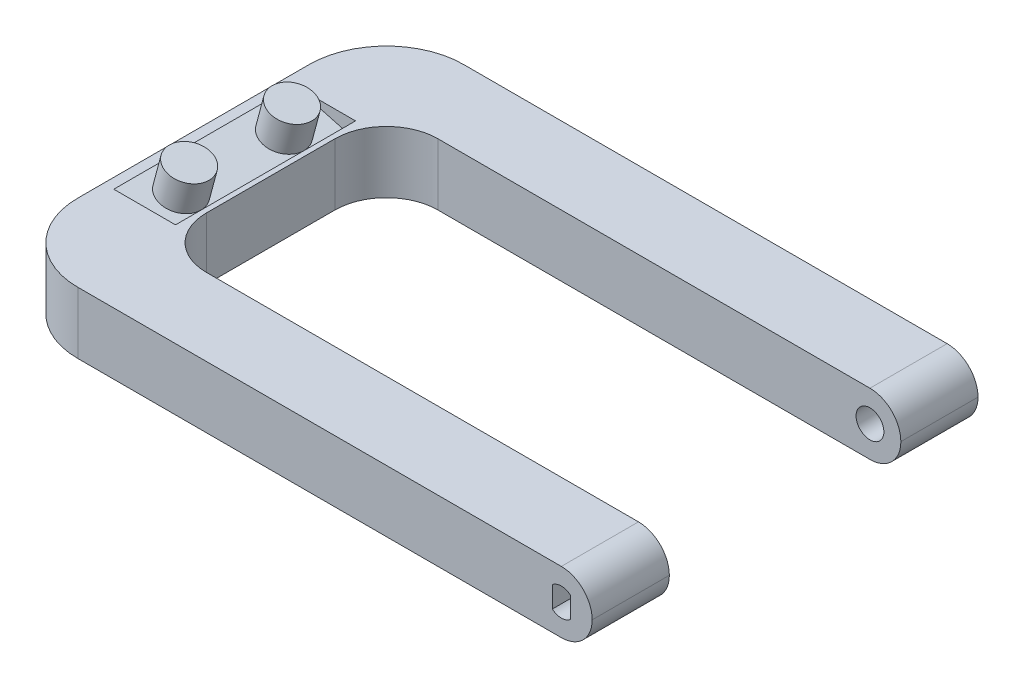
from build123d import *
from OCP.BRepFilletAPI import BRepFilletAPI_MakeFillet
from build123d.topology import SkipClean

# Parameters (mm, degrees)
BOSS_EXTRUDE1_DEPTH = 6
FILLET1_R           = 6
FILLET2_R1          = 10
FILLET2_R2          = 15
CUT_EXTRUDE1_DEPTH  = 17.5
SKETCH5_R           = 4
BOSS_EXTRUDE2_DEPTH = 6
CUT_EXTRUDE2_DEPTH  = 6
SKETCH7_R           = 2.7
CUT_EXTRUDE4_DEPTH  = 96.469302576


with BuildPart() as part:
    # Sketch1 → Boss-Extrude1 (new, symmetric)
    with BuildSketch(Plane(origin=(0, 0, 0), x_dir=(1, 0, 0), z_dir=(0, 1, 0))):
        Polygon((50, 37.5), (50, 22.5), (-50, 22.5), (-50, -22.5), (50, -22.5), (50, -37.5), (-65, -37.5), (-65, 37.5), align=None)
    extrude(amount=BOSS_EXTRUDE1_DEPTH, both=True)

    # Fillet1
    fillet1_edges = [part.edges().sort_by_distance(p)[0] for p in [
        (50, 6, -30),
        (50, -6, -30),
        (50, -6, 30),
        (50, 6, 30),
    ]]
    fillet(fillet1_edges, radius=FILLET1_R - 0.0001)  # a hair under: the kernel refuses the full size

    # Fillet2: one fillet with a radius per group of edges: ONE call of the kernel's fillet builder (fillet() takes one radius for all edges)
    fillet2_edges_1 = [part.edges().sort_by_distance(p)[0] for p in [
        (-50, 0, 22.5),
        (-50, 0, -22.5),
    ]]
    fillet2_edges_2 = [part.edges().sort_by_distance(p)[0] for p in [
        (-65, 0, 37.5),
        (-65, 0, -37.5),
    ]]
    fillet2 = BRepFilletAPI_MakeFillet(part.part.solid().wrapped)
    for e in fillet2_edges_1:
        fillet2.Add(FILLET2_R1, e.wrapped)
    for e in fillet2_edges_2:
        fillet2.Add(FILLET2_R2, e.wrapped)
    add(Compound.cast(fillet2.Shape()), mode=Mode.REPLACE)

    # Sketch4 → Cut-Extrude1 (cut, symmetric)
    with BuildSketch(Plane.XY):
        Polygon((-63, 6), (-51, 2.784609691), (-51, 6), align=None)
    extrude(amount=CUT_EXTRUDE1_DEPTH, both=True, mode=Mode.SUBTRACT)

    # Sketch5 → Boss-Extrude2 (add)
    with BuildSketch(Plane(origin=(-2.720199781, -10.151923789, 0), x_dir=(0.9659258262890701, -0.25881904510251424, 0), z_dir=(0.25881904510251424, 0.9659258262890701, 0))):
        with Locations((-56.610686369, 10)):
            Circle(SKETCH5_R)
        with Locations((-56.610686369, -10)):
            Circle(SKETCH5_R)
    extrude(amount=BOSS_EXTRUDE2_DEPTH)

    # Sketch6 → Cut-Extrude2 (cut)
    with BuildSketch(Plane.XY.offset(37.5)):
        with BuildLine():
            Line((42.25, -2.056088519), (42.25, 2.056088519))
            ThreePointArc((42.25, 2.056088519), (44, 2.7), (45.75, 2.056088519))
            Line((45.75, 2.056088519), (45.75, -2.056088519))
            ThreePointArc((45.75, -2.056088519), (44, -2.7), (42.25, -2.056088519))
        make_face()
    extrude(amount=-CUT_EXTRUDE2_DEPTH, mode=Mode.SUBTRACT)

    # Sketch7 → Cut-Extrude4 (cut, through all)
    with SkipClean():  # the faces are left unmerged after this step: merging them gives an invalid solid
        with BuildSketch(Plane.XY.offset(31.5)):
            with Locations((44, 0)):
                Circle(SKETCH7_R)
        extrude(amount=-CUT_EXTRUDE4_DEPTH, mode=Mode.SUBTRACT)


solid = part.part
